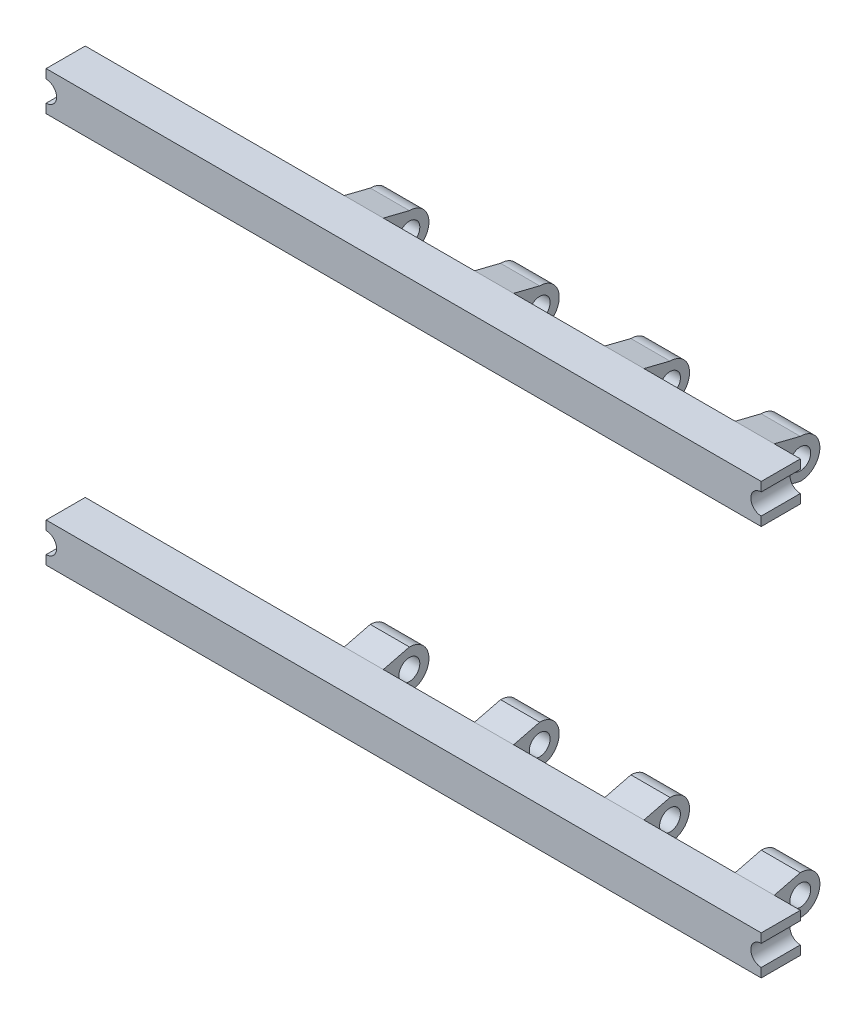
from build123d import *

# Parameters (mm, degrees)
SKETCH1_W             = 109.75
SKETCH1_H             = 6
BOSS_EXTRUDE1_DEPTH   = 6
BOSS_EXTRUDE1_2_DEPTH = 6
BOSS_EXTRUDE2_START   = -4
SKETCH2_R             = 1.6
BOSS_EXTRUDE2_DEPTH   = 6
LPATTERN1_COUNT       = 4
LPATTERN1_PITCH       = 20
CUT_EXTRUDE1_REACH    = 249.551
SKETCH3_R             = 1.6


with BuildPart() as part:
    # Sketch1 → Boss-Extrude1 (new body)
    with BuildSketch(Plane.XY):
        with Locations((57.875, -217)):
            Rectangle(SKETCH1_W, SKETCH1_H)
    extrude(amount=-BOSS_EXTRUDE1_DEPTH)



with BuildPart() as body_2:
    # Sketch1 → Boss-Extrude1 2 (new body)
    with BuildSketch(Plane.XY):
        with Locations((57.875, -157)):
            Rectangle(SKETCH1_W, SKETCH1_H)
    extrude(amount=-BOSS_EXTRUDE1_2_DEPTH)


with BuildPart() as part_1:
    add(part.part)

    add(body_2.part)  # Boss-Extrude2 merges body 2
    # Sketch2 → Boss-Extrude2 (add)
    # profile 1 of 2: a face of its own
    with BuildSketch(Plane(origin=(112.75, 0, 0), x_dir=(0, 0, -1), z_dir=(1, 0, 0)).offset(BOSS_EXTRUDE2_START)):
        with BuildLine():
            Line((6, -214), (6, -220))
            Line((6, -220), (10, -219))
            ThreePointArc((10, -219), (13, -216), (10, -213))
            Line((10, -213), (6, -214))
        make_face()
        with Locations((10, -216)):
            Circle(SKETCH2_R, mode=Mode.SUBTRACT)
    # profile 2 of 2: a face of its own
    with BuildSketch(Plane(origin=(112.75, 0, 0), x_dir=(0, 0, -1), z_dir=(1, 0, 0)).offset(BOSS_EXTRUDE2_START)):
        with BuildLine():
            Line((10, -155), (6, -154))
            Line((6, -154), (6, -160))
            Line((6, -160), (10, -161))
            ThreePointArc((10, -161), (13, -158), (10, -155))
        make_face()
        with Locations((10, -158)):
            Circle(SKETCH2_R, mode=Mode.SUBTRACT)
    boss_extrude2 = extrude(amount=-BOSS_EXTRUDE2_DEPTH)

    # LPattern1: Boss-Extrude2 ×4
    with Locations(*[(-i * LPATTERN1_PITCH, 0, 0) for i in range(1, LPATTERN1_COUNT)]):
        add(boss_extrude2)

    # Sketch3 → Cut-Extrude1 (cut, up to next)
    with BuildSketch(Plane.XY, mode=Mode.PRIVATE) as cut_extrude1_sk1:
        with Locations((3, -217)):
            Circle(SKETCH3_R)
    cut_extrude1_tool1 = extrude(cut_extrude1_sk1.sketch, amount=-CUT_EXTRUDE1_REACH, mode=Mode.PRIVATE) & part_1.part
    # Sketch3 → Cut-Extrude1 (cut, up to next)
    with BuildSketch(Plane.XY, mode=Mode.PRIVATE) as cut_extrude1_sk2:
        with Locations((3, -157)):
            Circle(SKETCH3_R)
    cut_extrude1_tool2 = extrude(cut_extrude1_sk2.sketch, amount=-CUT_EXTRUDE1_REACH, mode=Mode.PRIVATE) & part_1.part
    # Sketch3 → Cut-Extrude1 (cut, up to next)
    with BuildSketch(Plane.XY, mode=Mode.PRIVATE) as cut_extrude1_sk3:
        with Locations((112.75, -157)):
            Circle(SKETCH3_R)
    cut_extrude1_tool3 = extrude(cut_extrude1_sk3.sketch, amount=-CUT_EXTRUDE1_REACH, mode=Mode.PRIVATE) & part_1.part
    # Sketch3 → Cut-Extrude1 (cut, up to next)
    with BuildSketch(Plane.XY, mode=Mode.PRIVATE) as cut_extrude1_sk4:
        with Locations((112.75, -217)):
            Circle(SKETCH3_R)
    cut_extrude1_tool4 = extrude(cut_extrude1_sk4.sketch, amount=-CUT_EXTRUDE1_REACH, mode=Mode.PRIVATE) & part_1.part
    add(cut_extrude1_tool1.solids().sort_by_distance((3, -217, 0))[0], mode=Mode.SUBTRACT)
    add(cut_extrude1_tool2.solids().sort_by_distance((3, -157, 0))[0], mode=Mode.SUBTRACT)
    add(cut_extrude1_tool3.solids().sort_by_distance((112.75, -157, 0))[0], mode=Mode.SUBTRACT)
    add(cut_extrude1_tool4.solids().sort_by_distance((112.75, -217, 0))[0], mode=Mode.SUBTRACT)


solid = part_1.part
